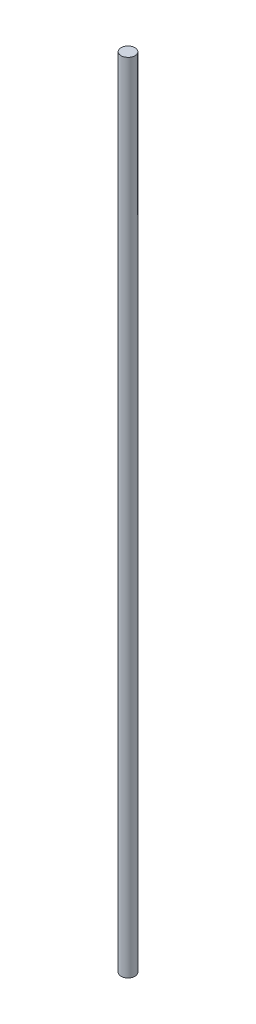
from build123d import *

# Parameters (mm, degrees)
SKETCH1_R           = 3.175
BOSS_EXTRUDE1_DEPTH = 364.009999998


with BuildPart() as part:
    # Sketch1 → Boss-Extrude1 (new body)
    with BuildSketch(Plane(origin=(0, 0, 0), x_dir=(1, 0, 0), z_dir=(0, 1, 0))):
        Circle(SKETCH1_R)
    extrude(amount=BOSS_EXTRUDE1_DEPTH)


solid = part.part
